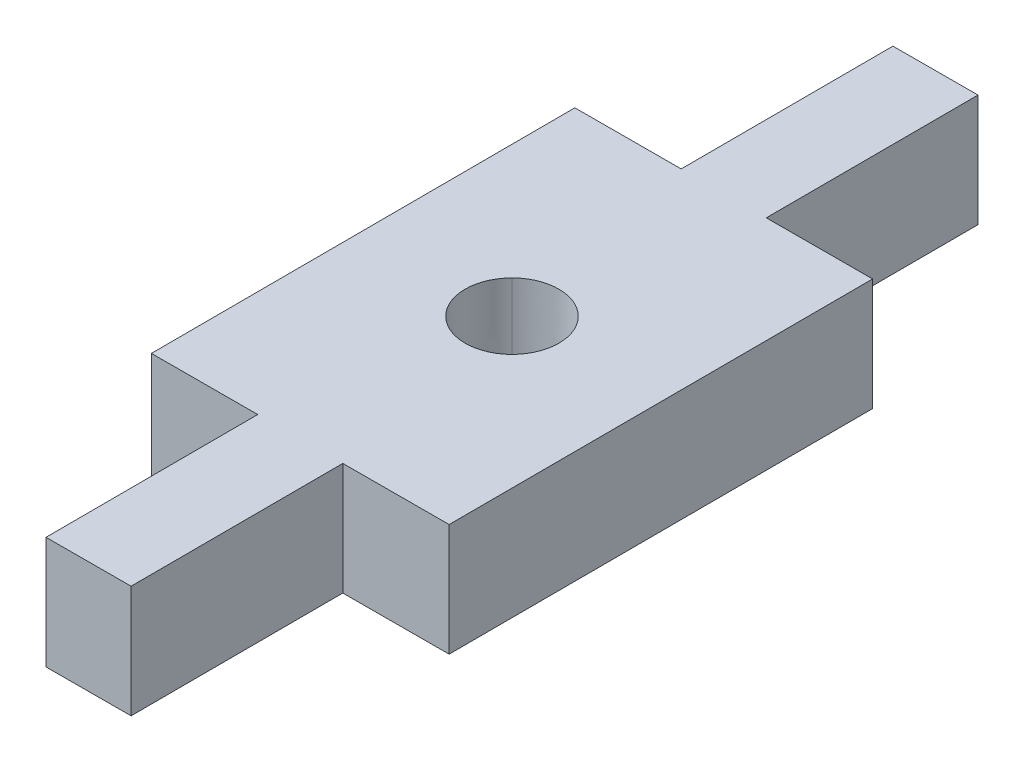
from build123d import *

# Parameters (mm, degrees)
BOSS_EXTRUDE1_DEPTH = 3.175


with BuildPart() as part:
    # Sketch1 → Boss-Extrude1 (new body)
    with BuildSketch(Plane(origin=(0, 0, 0), x_dir=(1, 0, 0), z_dir=(0, 1, 0))):
        Polygon((95.427760584, 114.606837226), (95.441160584, 108.606837226), (97.841160584, 108.612237226), (97.827560584, 114.612237226), (100.827660584, 114.619037226), (100.800760584, 126.618937226), (97.800760584, 126.612237226), (97.787360584, 132.612237226), (95.387360584, 132.606837226), (95.400860584, 126.606837226), (92.400760584, 126.600037226), (92.427760584, 114.600237226), align=None)
        with BuildLine():
            add(Edge.make_bspline(
                [(97.548860584, 121.548537226), (97.030460584, 122.064737226), (96.191460584, 122.062937226), (95.675160584, 121.544337226)],
                knots=[0, 0, 0, 0, 0.2, 0.2, 0.2, 0.2], degree=3))
            add(Edge.make_bspline(
                [(95.675160584, 121.544337226), (95.158860584, 121.025837226), (95.160860584, 120.186737226), (95.679460584, 119.670537226)],
                knots=[0.2, 0.2, 0.2, 0.2, 0.4, 0.4, 0.4, 0.4], degree=3))
            add(Edge.make_bspline(
                [(95.679460584, 119.670537226), (96.197960584, 119.154237226), (97.036960584, 119.156237226), (97.553160584, 119.674837226)],
                knots=[0.4, 0.4, 0.4, 0.4, 0.6, 0.6, 0.6, 0.6], degree=3))
            add(Edge.make_bspline(
                [(97.553160584, 119.674837226), (98.069560584, 120.193337226), (98.067560584, 121.032237226), (97.548860584, 121.548537226)],
                knots=[0.6, 0.6, 0.6, 0.6, 1, 1, 1, 1], degree=3))
        make_face(mode=Mode.SUBTRACT)
    extrude(amount=BOSS_EXTRUDE1_DEPTH)


solid = part.part
